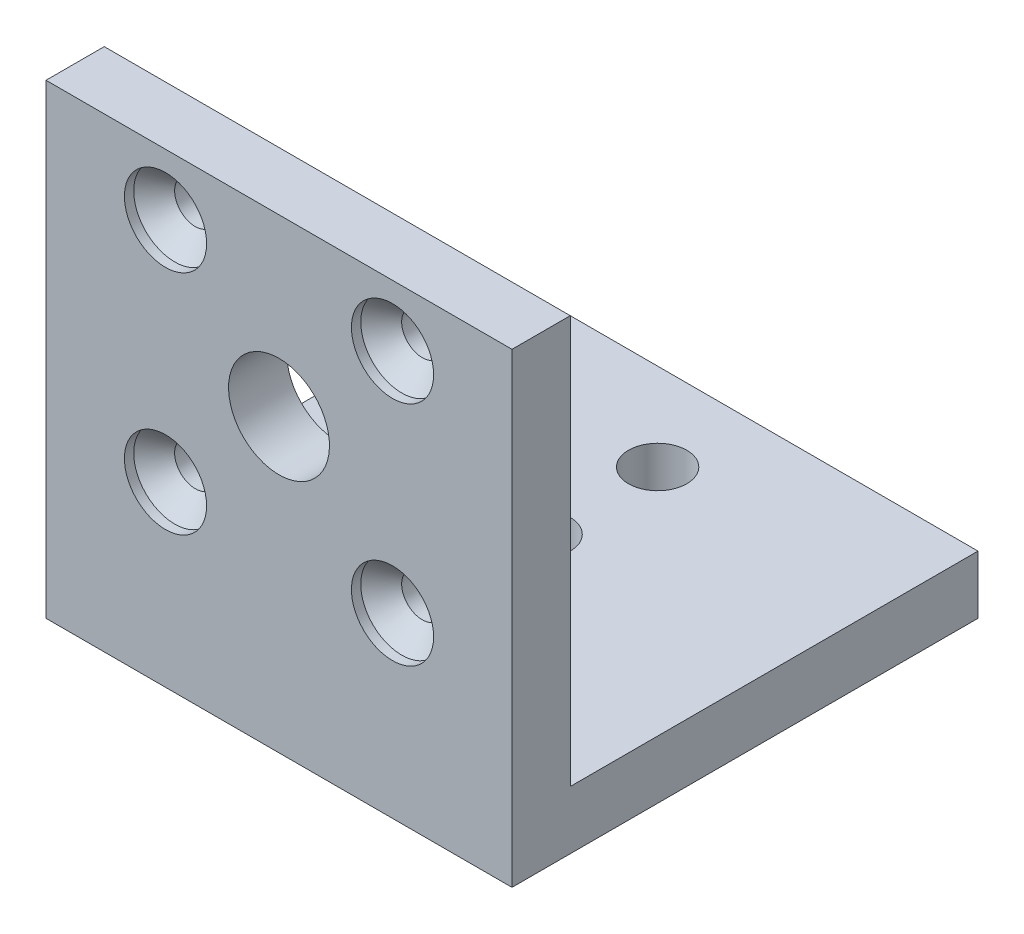
from build123d import *

# Parameters (mm, degrees)
BOSS_EXTRUDE1_DEPTH          = 50.8
CUT_EXTRUDE1_REACH           = 86.481
SKETCH2_R                    = 2.25
SKETCH2_R_2                  = 5.5
CUT_EXTRUDE2_REACH           = 82.822
SKETCH4_R                    = 3.175
CSK_FOR_M4_SFHCS1_AT_2_COUNT = 2
CSK_FOR_M4_SFHCS1_AT_2_PITCH = 24.748737342
CSK_FOR_M4_SFHCS1_AT_3_COUNT = 2
CSK_FOR_M4_SFHCS1_AT_3_PITCH = 35
CSK_FOR_M4_SFHCS1_AT_4_COUNT = 2
CSK_FOR_M4_SFHCS1_AT_4_PITCH = 24.748737342


with BuildPart() as part:
    # Sketch1 → Boss-Extrude1 (new body)
    with BuildSketch(Plane(origin=(0, 0, 0), x_dir=(0, 0, -1), z_dir=(1, 0, 0))):
        Polygon((0, 0), (0, -44.45), (44.45, -44.45), (44.45, -50.8), (-6.35, -50.8), (-6.35, 0), align=None)
    extrude(amount=BOSS_EXTRUDE1_DEPTH)

    # Sketch2 → Cut-Extrude1 (cut, up to next)
    with BuildSketch(Plane(origin=(0, 0, 0), x_dir=(-1, 0, 0), z_dir=(0, 0, -1)), mode=Mode.PRIVATE) as cut_extrude1_sk1:
        with Locations((-13.025631329, -6.675631329)):
            Circle(SKETCH2_R)
    cut_extrude1_tool1 = extrude(cut_extrude1_sk1.sketch, amount=-CUT_EXTRUDE1_REACH, mode=Mode.PRIVATE) & part.part
    # Sketch2 → Cut-Extrude1 (cut, up to next)
    with BuildSketch(Plane(origin=(0, 0, 0), x_dir=(-1, 0, 0), z_dir=(0, 0, -1)), mode=Mode.PRIVATE) as cut_extrude1_sk2:
        with Locations((-13.025631329, -31.424368671)):
            Circle(SKETCH2_R)
    cut_extrude1_tool2 = extrude(cut_extrude1_sk2.sketch, amount=-CUT_EXTRUDE1_REACH, mode=Mode.PRIVATE) & part.part
    # Sketch2 → Cut-Extrude1 (cut, up to next)
    with BuildSketch(Plane(origin=(0, 0, 0), x_dir=(-1, 0, 0), z_dir=(0, 0, -1)), mode=Mode.PRIVATE) as cut_extrude1_sk3:
        with Locations((-37.774368671, -31.424368671)):
            Circle(SKETCH2_R)
    cut_extrude1_tool3 = extrude(cut_extrude1_sk3.sketch, amount=-CUT_EXTRUDE1_REACH, mode=Mode.PRIVATE) & part.part
    # Sketch2 → Cut-Extrude1 (cut, up to next)
    with BuildSketch(Plane(origin=(0, 0, 0), x_dir=(-1, 0, 0), z_dir=(0, 0, -1)), mode=Mode.PRIVATE) as cut_extrude1_sk4:
        with Locations((-37.774368671, -6.675631329)):
            Circle(SKETCH2_R)
    cut_extrude1_tool4 = extrude(cut_extrude1_sk4.sketch, amount=-CUT_EXTRUDE1_REACH, mode=Mode.PRIVATE) & part.part
    # Sketch2 → Cut-Extrude1 (cut, up to next)
    with BuildSketch(Plane(origin=(0, 0, 0), x_dir=(-1, 0, 0), z_dir=(0, 0, -1)), mode=Mode.PRIVATE) as cut_extrude1_sk5:
        with Locations((-25.4, -19.05)):
            Circle(SKETCH2_R_2)
    cut_extrude1_tool5 = extrude(cut_extrude1_sk5.sketch, amount=-CUT_EXTRUDE1_REACH, mode=Mode.PRIVATE) & part.part
    add(cut_extrude1_tool1.solids().sort_by_distance((13.025631, -6.675631, 0))[0], mode=Mode.SUBTRACT)
    add(cut_extrude1_tool2.solids().sort_by_distance((13.025631, -31.424369, 0))[0], mode=Mode.SUBTRACT)
    add(cut_extrude1_tool3.solids().sort_by_distance((37.774369, -31.424369, 0))[0], mode=Mode.SUBTRACT)
    add(cut_extrude1_tool4.solids().sort_by_distance((37.774369, -6.675631, 0))[0], mode=Mode.SUBTRACT)
    add(cut_extrude1_tool5.solids().sort_by_distance((25.4, -19.05, 0))[0], mode=Mode.SUBTRACT)

    # Sketch4 → Cut-Extrude2 (cut, up to next)
    with BuildSketch(Plane(origin=(0, -44.45, 0), x_dir=(1, 0, 0), z_dir=(0, 1, 0)), mode=Mode.PRIVATE) as cut_extrude2_sk1:
        with Locations((25.4, 34.925)):
            Circle(SKETCH4_R)
    cut_extrude2_tool1 = extrude(cut_extrude2_sk1.sketch, amount=-CUT_EXTRUDE2_REACH, mode=Mode.PRIVATE) & part.part
    # Sketch4 → Cut-Extrude2 (cut, up to next)
    with BuildSketch(Plane(origin=(0, -44.45, 0), x_dir=(1, 0, 0), z_dir=(0, 1, 0)), mode=Mode.PRIVATE) as cut_extrude2_sk2:
        with Locations((25.4, 22.225)):
            Circle(SKETCH4_R)
    cut_extrude2_tool2 = extrude(cut_extrude2_sk2.sketch, amount=-CUT_EXTRUDE2_REACH, mode=Mode.PRIVATE) & part.part
    add(cut_extrude2_tool1.solids().sort_by_distance((25.4, -44.45, -34.925))[0], mode=Mode.SUBTRACT)
    add(cut_extrude2_tool2.solids().sort_by_distance((25.4, -44.45, -22.225))[0], mode=Mode.SUBTRACT)

    # Sketch5 → CSK for M4 SFHCS1 (revolve, cut)
    with BuildSketch(Plane(origin=(13.025631329, -6.675631329, 6.35), x_dir=(0, -1, 0), z_dir=(1, 0, 0))):
        Polygon((0, 0), (0, 50.8), (2.15, 50.8), (2.15, 3.346), (4.48, 1.016), (4.48, 0), align=None)
    csk_for_m4_sfhcs1 = revolve(axis=Axis((13.025631329, -6.675631329, 12.7), (0, 0, -1)), mode=Mode.SUBTRACT)

    # CSK for M4 SFHCS1 at 2: CSK for M4 SFHCS1 ×2
    with Locations(*[(i * CSK_FOR_M4_SFHCS1_AT_2_PITCH, 0, 0) for i in range(1, CSK_FOR_M4_SFHCS1_AT_2_COUNT)]):
        add(csk_for_m4_sfhcs1, mode=Mode.SUBTRACT)

    # CSK for M4 SFHCS1 at 3: CSK for M4 SFHCS1 ×2
    with Locations(*[Vector(0.7071067811865426, -0.7071067811865525, 0) * (i * CSK_FOR_M4_SFHCS1_AT_3_PITCH) for i in range(1, CSK_FOR_M4_SFHCS1_AT_3_COUNT)]):
        add(csk_for_m4_sfhcs1, mode=Mode.SUBTRACT)

    # CSK for M4 SFHCS1 at 4: CSK for M4 SFHCS1 ×2
    with Locations(*[(0, -i * CSK_FOR_M4_SFHCS1_AT_4_PITCH, 0) for i in range(1, CSK_FOR_M4_SFHCS1_AT_4_COUNT)]):
        add(csk_for_m4_sfhcs1, mode=Mode.SUBTRACT)


solid = part.part
